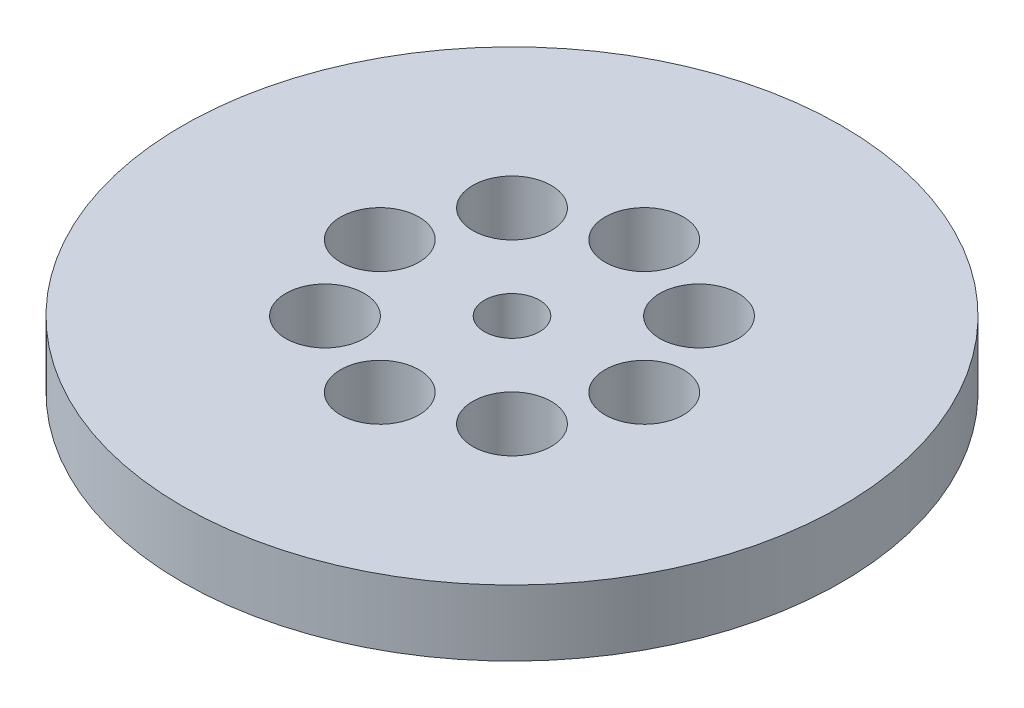
from build123d import *

# Parameters (mm, degrees)
SKETCH1_R           = 60
BOSS_EXTRUDE1_DEPTH = 12
SKETCH2_R           = 5
CUT_EXTRUDE1_DEPTH  = 86.697141143
SKETCH3_R           = 7.138106905
CUT_EXTRUDE2_DEPTH  = 10.781413925
CIRPATTERN1_COUNT   = 8


with BuildPart() as part:
    # Sketch1 → Boss-Extrude1 (new body)
    with BuildSketch(Plane(origin=(0, 0, 0), x_dir=(1, 0, 0), z_dir=(0, 1, 0))):
        Circle(SKETCH1_R)
    extrude(amount=BOSS_EXTRUDE1_DEPTH)

    # Sketch2 → Cut-Extrude1 (cut, through all)
    with BuildSketch(Plane(origin=(0, 0, 0), x_dir=(1, 0, 0), z_dir=(0, 1, 0))):
        Circle(SKETCH2_R)
    extrude(amount=CUT_EXTRUDE1_DEPTH, mode=Mode.SUBTRACT)

    # Sketch3 → Cut-Extrude2 (cut)
    with BuildSketch(Plane(origin=(0, 12, 0), x_dir=(1, 0, 0), z_dir=(0, 1, 0))):
        with Locations((-24.075912496, 0)):
            Circle(SKETCH3_R)
    cut_extrude2 = extrude(amount=-CUT_EXTRUDE2_DEPTH, mode=Mode.SUBTRACT)

    # CirPattern1: Cut-Extrude2 ×8 about axis
    cirpattern1_axis = Axis((0, 0, 0), (0, 1, 0))
    for i in range(1, CIRPATTERN1_COUNT):
        add(cut_extrude2.rotate(cirpattern1_axis, i * 360 / CIRPATTERN1_COUNT), mode=Mode.SUBTRACT)


solid = part.part
